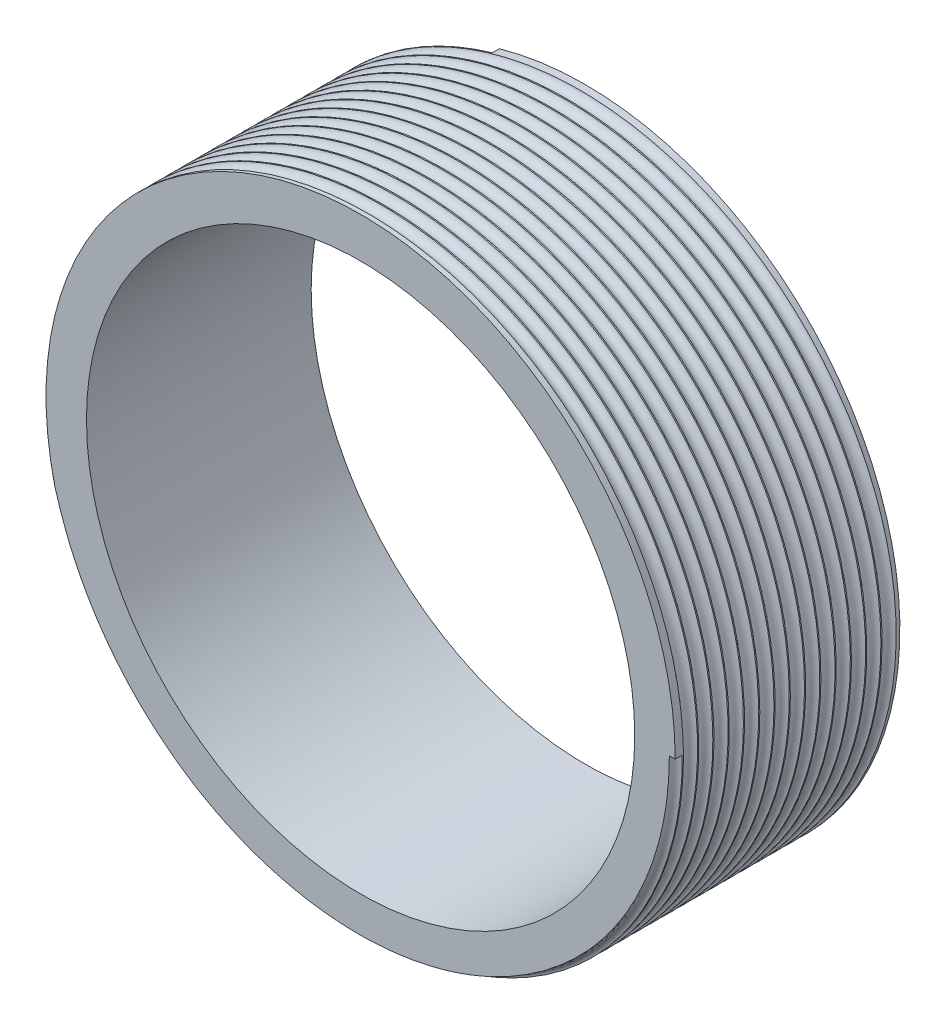
from build123d import *

# Parameters (mm, degrees)
SKETCH1_R           = 70
SKETCH1_R_2         = 61
BOSS_EXTRUDE1_DEPTH = 25
CUT_SWEEP1_PITCH    = 3.4


with BuildPart() as part:
    # Sketch1 → Boss-Extrude1 (new, symmetric)
    with BuildSketch(Plane.XY):
        Circle(SKETCH1_R)
        Circle(SKETCH1_R_2, mode=Mode.SUBTRACT)
    extrude(amount=BOSS_EXTRUDE1_DEPTH, both=True)

    # Cut-Sweep1: arcs per turn and ends read off the stored shape
    # Cut-Sweep1: the profile of Cut-Sweep1 profile screwed along a right-hand helix through 14.705882 turns, 12 arcs to a turn; built about Z, then put on its axis
    cut_sweep1_z = Axis((0, 0, 0), (0, 0, 1))
    cut_sweep1_corners = [(70.3, -0.012315466, 1.599952602), (71.9, 0, 0), (70.3, 0.012315466, -1.599952602), (68.7, 0, 0)]
    with BuildLine(mode=Mode.PRIVATE) as cut_sweep1_profile:
        ThreePointArc((70.3, -0.012315466, 1.599952602), (71.43137085, -0.008708349, 1.131337335), (71.9, 0, 0))
        ThreePointArc((71.9, 0, 0), (71.43137085, 0.008708349, -1.131337335), (70.3, 0.012315466, -1.599952602))
        ThreePointArc((70.3, 0.012315466, -1.599952602), (69.16862915, 0.008708349, -1.131337335), (68.7, 0, 0))
        ThreePointArc((68.7, 0, 0), (69.16862915, -0.008708349, 1.131337335), (70.3, -0.012315466, 1.599952602))
    cut_sweep1_cap = Face(cut_sweep1_profile.wire())
    cut_sweep1_arcs = [((70.3, -0.012315466, 1.599952602), (71.9, -0.012315466, 1.599952602), (71.9, 0, 0), (1, 0.7071067811865475, 1)), ((71.9, 0, 0), (71.9, 0.012315466, -1.599952602), (70.3, 0.012315466, -1.599952602), (1, 0.7071067811865475, 1)), ((70.3, 0.012315466, -1.599952602), (68.7, 0.012315466, -1.599952602), (68.7, 0, 0), (1, 0.7071067811865475, 1)), ((68.7, 0, 0), (68.7, -0.012315466, 1.599952602), (70.3, -0.012315466, 1.599952602), (1, 0.7071067811865475, 1))]  # start, shoulder, end, weights
    cut_sweep1_turn_angles = [0, 15, 30, 45, 60, 75, 90, 105, 120, 135, 150, 165, 180, 195, 210, 225, 240, 255, 270, 285, 300, 315, 330, 345, 360]
    cut_sweep1_turn_weights = [1, 0.9659258262890683, 1, 0.9659258262890683, 1, 0.9659258262890683, 1, 0.9659258262890683, 1, 0.9659258262890683, 1, 0.9659258262890683, 1, 0.9659258262890683, 1, 0.9659258262890683, 1, 0.9659258262890683, 1, 0.9659258262890683, 1, 0.9659258262890683, 1, 0.9659258262890683, 1]
    cut_sweep1_turn_sides = [Face.make_bezier_surface([[Vector(p[j][0], p[j][1], 0).rotate(cut_sweep1_z, cut_sweep1_turn_angles[2 * i + k]) / cut_sweep1_turn_weights[2 * i + k] + Vector(0, 0, p[j][2] + CUT_SWEEP1_PITCH * cut_sweep1_turn_angles[2 * i + k] / 360) for k in range(3)] for j in range(3)], [[p[3][j] * cut_sweep1_turn_weights[2 * i + k] for k in range(3)] for j in range(3)]) for p in cut_sweep1_arcs for i in range(12)]
    cut_sweep1_last_angles = [5040, 5055, 5070, 5085, 5100, 5115, 5130, 5145, 5160, 5175, 5190, 5205, 5220, 5235, 5250, 5265, 5280, 5287.058823529, 5294.117647059]
    cut_sweep1_last_weights = [1, 0.9659258262890683, 1, 0.9659258262890683, 1, 0.9659258262890683, 1, 0.9659258262890683, 1, 0.9659258262890683, 1, 0.9659258262890683, 1, 0.9659258262890683, 1, 0.9659258262890683, 1, 0.9924205096720237, 1]
    cut_sweep1_last_sides = [Face.make_bezier_surface([[Vector(p[j][0], p[j][1], 0).rotate(cut_sweep1_z, cut_sweep1_last_angles[2 * i + k]) / cut_sweep1_last_weights[2 * i + k] + Vector(0, 0, p[j][2] + CUT_SWEEP1_PITCH * cut_sweep1_last_angles[2 * i + k] / 360) for k in range(3)] for j in range(3)], [[p[3][j] * cut_sweep1_last_weights[2 * i + k] for k in range(3)] for j in range(3)]) for p in cut_sweep1_arcs for i in range(9)]
    cut_sweep1 = Plane(origin=(0, 0, 25), x_dir=(1, 0, 0), z_dir=(0, 0, -1)) * Solid(Shell([*[p.moved(Location((0, 0, CUT_SWEEP1_PITCH * i))) for i in range(14) for p in cut_sweep1_turn_sides], *cut_sweep1_last_sides, cut_sweep1_cap, cut_sweep1_cap.rotate(cut_sweep1_z, 5294.117647059).moved(Location((0, 0, CUT_SWEEP1_PITCH * 5294.117647059 / 360)))]))
    add(cut_sweep1, mode=Mode.SUBTRACT)


solid = part.part
